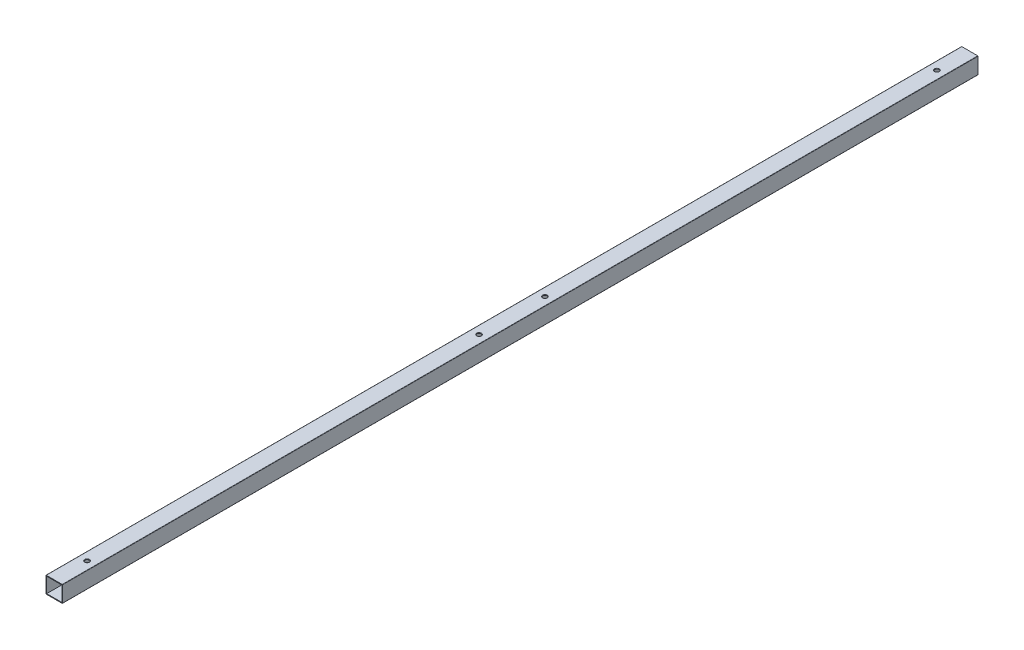
from build123d import *

# Parameters (mm, degrees)
SKETCH2_W                = 38.1
SKETCH2_H                = 38.1
SKETCH2_W_2              = 34.925
SKETCH2_H_2              = 34.925
BOSS_EXTRUDE1_DEPTH      = 2120.9
X_0_397_DIAMETER_HOLE1_D = 10.0838
FILLET3_R                = 0.635


with BuildPart() as part:
    # Sketch2 → Boss-Extrude1 (new body)
    with BuildSketch(Plane.XY):
        with Locations((19.05, 19.05)):
            Rectangle(SKETCH2_W, SKETCH2_H)
        with Locations((19.05, 19.05)):
            Rectangle(SKETCH2_W_2, SKETCH2_H_2, mode=Mode.SUBTRACT)
    extrude(amount=BOSS_EXTRUDE1_DEPTH)

    # X (0.397) Diameter Hole1 (through all)
    with Locations(Plane(origin=(0, 0, 0), x_dir=(-1, 0, 0), z_dir=(0, -1, 0))):
        with Locations((-19.05, -2044.7), (-19.05, -1136.65), (-19.05, -984.25), (-19.05, -76.2)):
            Hole(X_0_397_DIAMETER_HOLE1_D / 2)

    # Fillet3
    fillet3_edges = [part.edges().sort_by_distance(p)[0] for p in [
        (14.0081, 38.1, 76.2),
        (14.0081, 36.5125, 76.2),
        (14.0081, 0, 76.2),
        (14.0081, 1.5875, 76.2),
        (14.0081, 38.1, 984.25),
        (14.0081, 36.5125, 984.25),
        (14.0081, 0, 984.25),
        (14.0081, 1.5875, 984.25),
        (14.0081, 38.1, 1136.65),
        (14.0081, 36.5125, 1136.65),
        (14.0081, 0, 1136.65),
        (14.0081, 1.5875, 1136.65),
        (14.0081, 38.1, 2044.7),
        (14.0081, 36.5125, 2044.7),
        (14.0081, 0, 2044.7),
        (14.0081, 1.5875, 2044.7),
        (38.1, 0, 1060.45),
        (0, 0, 1060.45),
        (38.1, 38.1, 1060.45),
        (0, 38.1, 1060.45),
    ]]
    fillet(fillet3_edges, radius=FILLET3_R)


solid = part.part
